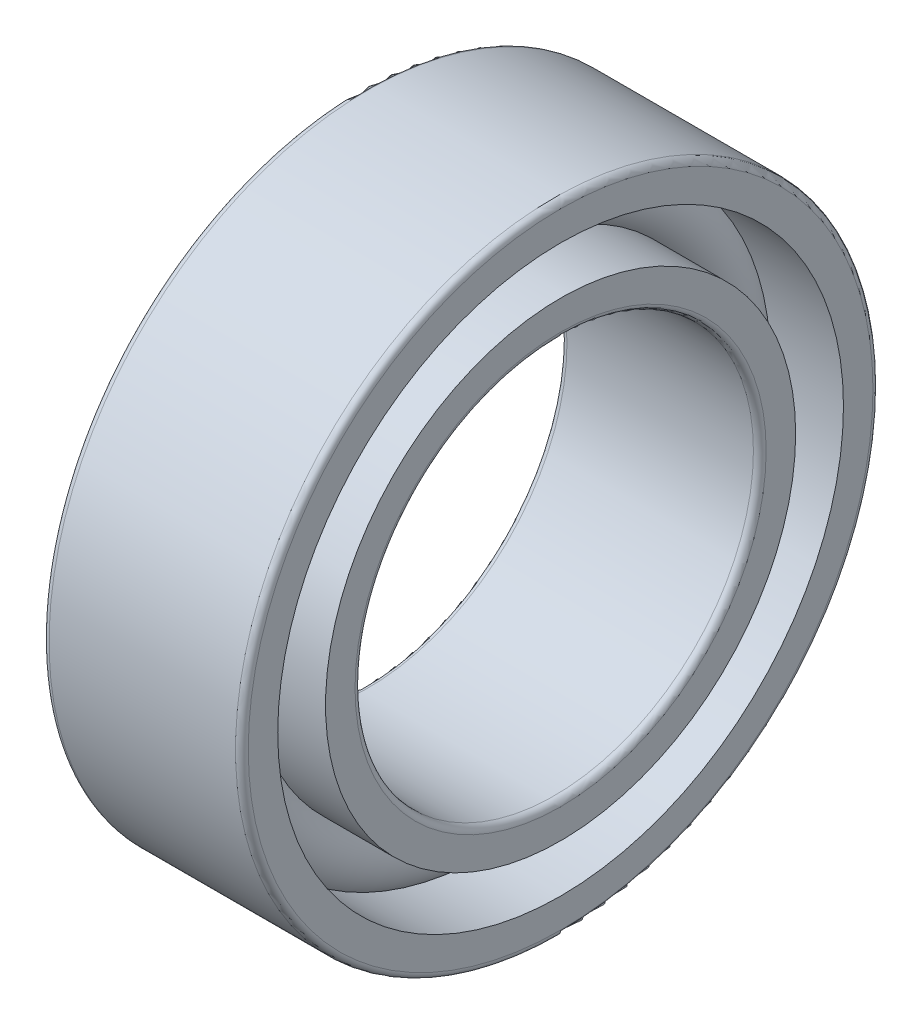
from build123d import *

# Parameters (mm, degrees)
CAGSPISKE_W     = 0.09
CAGSPISKE_H     = 0.15
CAGESPINE_ANGLE = 0.001
BALSIMSKE_R     = 0.45


with BuildPart() as part:
    # CagSpiSke → CageSpine (revolve)
    with BuildSketch(Plane.XY):
        with Locations((0, 3.25)):
            Rectangle(CAGSPISKE_W, CAGSPISKE_H)
    revolve(axis=Axis((-20.6375, 0, 0), (-1, 0, 0)), revolution_arc=CAGESPINE_ANGLE)

    # BalSimSke → BallsSimplified (revolve)
    with BuildSketch(Plane.XY):
        with Locations((0, 3.25)):
            Circle(BALSIMSKE_R)
    revolve(axis=Axis((-10, 0, 0), (1, 0, 0)))

    # InnRacSke → InnerRace (revolve)
    with BuildSketch(Plane.XY):
        with BuildLine():
            Line((-0.301039864, 2.95), (-1.25, 2.95))
            Line((-1.25, 2.95), (-1.25, 2.58))
            ThreePointArc((-1.25, 2.58), (-1.226568542, 2.523431458), (-1.17, 2.5))
            Line((-1.17, 2.5), (1.17, 2.5))
            ThreePointArc((1.17, 2.5), (1.226568542, 2.523431458), (1.25, 2.58))
            Line((1.25, 2.58), (1.25, 2.95))
            Line((1.25, 2.95), (0.301039864, 2.95))
            ThreePointArc((0.301039864, 2.95), (0, 2.825), (-0.301039864, 2.95))
        make_face()
    revolve(axis=Axis((-20.6375, 0, 0), (1, 0, 0)))

    # OutRacSke → OuterRace (revolve)
    with BuildSketch(Plane.XY):
        with BuildLine():
            Line((-0.301039864, 3.55), (-1.25, 3.55))
            Line((-1.25, 3.55), (-1.25, 3.92))
            ThreePointArc((-1.25, 3.92), (-1.226568542, 3.976568542), (-1.17, 4))
            Line((-1.17, 4), (1.17, 4))
            ThreePointArc((1.17, 4), (1.226568542, 3.976568542), (1.25, 3.92))
            Line((1.25, 3.92), (1.25, 3.55))
            Line((1.25, 3.55), (0.301039864, 3.55))
            ThreePointArc((0.301039864, 3.55), (0, 3.675), (-0.301039864, 3.55))
        make_face()
    revolve(axis=Axis((-20.6375, 0, 0), (1, 0, 0)))


solid = part.part
